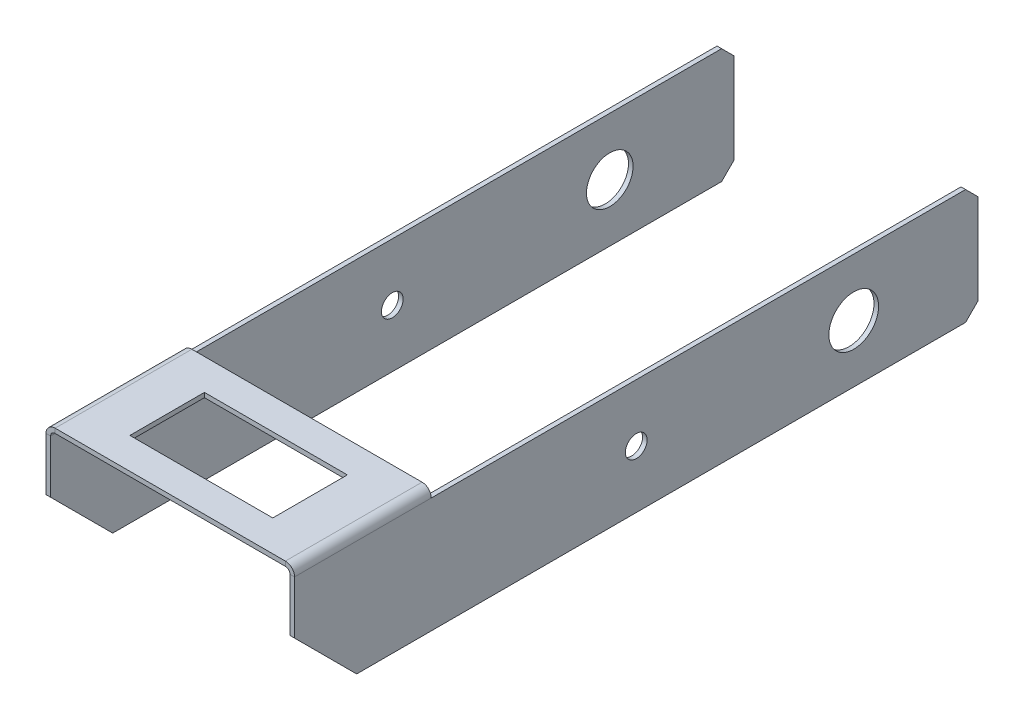
from build123d import *

# Parameters (mm, degrees)
SKETCH1_W                      = 40
SKETCH1_H                      = 22
BASE_FLANGE2_DEPTH             = 0.7366
EDGE_FLANGE2_STRIP_W           = 4.4196
EDGE_FLANGE2_STRIP_H           = 0.7366
EDGE_FLANGE2_STRIP_CUT_DEPTH   = 22
EDGE_FLANGE2_STRIP_2_W         = 4.4196
EDGE_FLANGE2_STRIP_2_H         = 0.7366
EDGE_FLANGE2_STRIP_CUT_2_DEPTH = 22
EDGE_FLANGE2_DEPTH             = 22
EDGE_FLANGE2_PROFILE_W         = 110
EDGE_FLANGE2_PROFILE_H         = 18.5268
EDGE_FLANGE2_FLAT_DEPTH        = 0.7366
EDGE_FLANGE2_BEND_DEPTH        = 22
EDGE_FLANGE2_PROFILE_2_W       = 110
EDGE_FLANGE2_PROFILE_2_H       = 18.5268
EDGE_FLANGE2_FLAT_2_DEPTH      = 0.7366
SKETCH32_R                     = 3.75
SKETCH32_R_2                   = 1.75
CUT_EXTRUDE1_DEPTH             = 2
CUT_EXTRUDE2_START             = -2
SKETCH33_R                     = 1.75
SKETCH33_R_2                   = 4
CUT_EXTRUDE2_DEPTH             = 2
CHAMFER1_SIZE                  = 2
CHAMFER2_SIZE                  = 10
SKETCH34_W                     = 23
SKETCH34_H                     = 12
CUT_EXTRUDE3_DEPTH             = 2


# Sheet-metal steps are written as plain solids
with BuildPart() as part:
    # Sketch1 → Base-Flange2 (new body)
    with BuildSketch(Plane(origin=(0, 0, 0), x_dir=(1, 0, 0), z_dir=(0, 1, 0))):
        Rectangle(SKETCH1_W, SKETCH1_H)
    extrude(amount=BASE_FLANGE2_DEPTH)

    # Edge-Flange2 strip (across the edge) → Edge-Flange2 strip cut (cut)
    with BuildSketch(Plane(origin=(20, 0, -11), x_dir=(-1, 0, 0), z_dir=(0, 0, 1))):
        with Locations((-0.7366, -0.3683)):
            Rectangle(EDGE_FLANGE2_STRIP_W, EDGE_FLANGE2_STRIP_H)
    extrude(amount=EDGE_FLANGE2_STRIP_CUT_DEPTH, mode=Mode.SUBTRACT)

    # Edge-Flange2 strip 2 (across the edge) → Edge-Flange2 strip cut 2 (cut)
    with BuildSketch(Plane(origin=(-20, 0, 11), x_dir=(1, 0, 0), z_dir=(0, 0, -1))):
        with Locations((-0.7366, -0.3683)):
            Rectangle(EDGE_FLANGE2_STRIP_2_W, EDGE_FLANGE2_STRIP_2_H)
    extrude(amount=EDGE_FLANGE2_STRIP_CUT_2_DEPTH, mode=Mode.SUBTRACT)

    # Edge-Flange2 bend section (across the edge) → Edge-Flange2 (add)
    with BuildSketch(Plane(origin=(20, 0, -11), x_dir=(-1, 0, 0), z_dir=(0, 0, 1))):
        with BuildLine():
            Line((0, 0.7366), (0.7366, 0.7366))
            ThreePointArc((0.7366, 0.7366), (0.952345145, 0.215745145), (1.4732, 0))
            Line((1.4732, 0), (1.4732, -0.7366))
            ThreePointArc((1.4732, -0.7366), (0.43149029, -0.30510971), (0, 0.7366))
        make_face()
    extrude(amount=EDGE_FLANGE2_DEPTH)

    # Edge-Flange2 profile (on flange) → Edge-Flange2 flat (add)
    with BuildSketch(Plane(origin=(20, 0, 0), x_dir=(0, 0, -1), z_dir=(-1, 0, 0))):
        with Locations((44, 10)):
            Rectangle(EDGE_FLANGE2_PROFILE_W, EDGE_FLANGE2_PROFILE_H)
    extrude(amount=EDGE_FLANGE2_FLAT_DEPTH)

    # Edge-Flange2 bend section 2 (across the edge) → Edge-Flange2 bend (add)
    with BuildSketch(Plane(origin=(-20, 0, 11), x_dir=(1, 0, 0), z_dir=(0, 0, -1))):
        with BuildLine():
            Line((0, 0.7366), (0.7366, 0.7366))
            ThreePointArc((0.7366, 0.7366), (0.952345145, 0.215745145), (1.4732, 0))
            Line((1.4732, 0), (1.4732, -0.7366))
            ThreePointArc((1.4732, -0.7366), (0.43149029, -0.30510971), (0, 0.7366))
        make_face()
    extrude(amount=EDGE_FLANGE2_BEND_DEPTH)

    # Edge-Flange2 profile 2 (on flange) → Edge-Flange2 flat 2 (add)
    with BuildSketch(Plane(origin=(-20, 0, 0), x_dir=(0, 0, 1), z_dir=(1, 0, 0))):
        with Locations((-44, 10)):
            Rectangle(EDGE_FLANGE2_PROFILE_2_W, EDGE_FLANGE2_PROFILE_2_H)
    extrude(amount=EDGE_FLANGE2_FLAT_2_DEPTH)

    # Sketch32 → Cut-Extrude1 (cut)
    with BuildSketch(Plane.ZY.offset(20)):
        with Locations(Location((-79, -10, 0), (0, 0, 270))):
            Circle(SKETCH32_R)
        with Locations(Location((-44, -10, 0), (0, 0, 270))):
            Circle(SKETCH32_R_2)
    extrude(amount=-CUT_EXTRUDE1_DEPTH, mode=Mode.SUBTRACT)

    # Sketch33 → Cut-Extrude2 (cut)
    with BuildSketch(Plane(origin=(20, 0, 0), x_dir=(0, 0, -1), z_dir=(1, 0, 0)).offset(CUT_EXTRUDE2_START)):
        with Locations(Location((44, -10, 0), (0, 0, 270))):
            Circle(SKETCH33_R)
        with Locations(Location((79, -10, 0), (0, 0, 90))):
            Circle(SKETCH33_R_2)
    extrude(amount=CUT_EXTRUDE2_DEPTH, mode=Mode.SUBTRACT)

    # Chamfer1
    chamfer1_edges = [part.edges().sort_by_distance(p)[0] for p in [
        (19.6317, -0.7366, -99),
        (19.6317, -19.2634, -99),
        (-19.6317, -0.7366, -99),
        (-19.6317, -19.2634, -99),
    ]]
    chamfer(chamfer1_edges, length=CHAMFER1_SIZE)

    # Chamfer2
    chamfer2_edges = [part.edges().sort_by_distance(p)[0] for p in [
        (19.6317, -19.2634, 11),
        (-19.6317, -19.2634, 11),
    ]]
    chamfer(chamfer2_edges, length=CHAMFER2_SIZE)

    # Sketch34 → Cut-Extrude3 (cut)
    with BuildSketch(Plane(origin=(0, 0.7366, 0), x_dir=(1, 0, 0), z_dir=(0, 1, 0))):
        Rectangle(SKETCH34_W, SKETCH34_H)
    extrude(amount=-CUT_EXTRUDE3_DEPTH, mode=Mode.SUBTRACT)


solid = part.part
